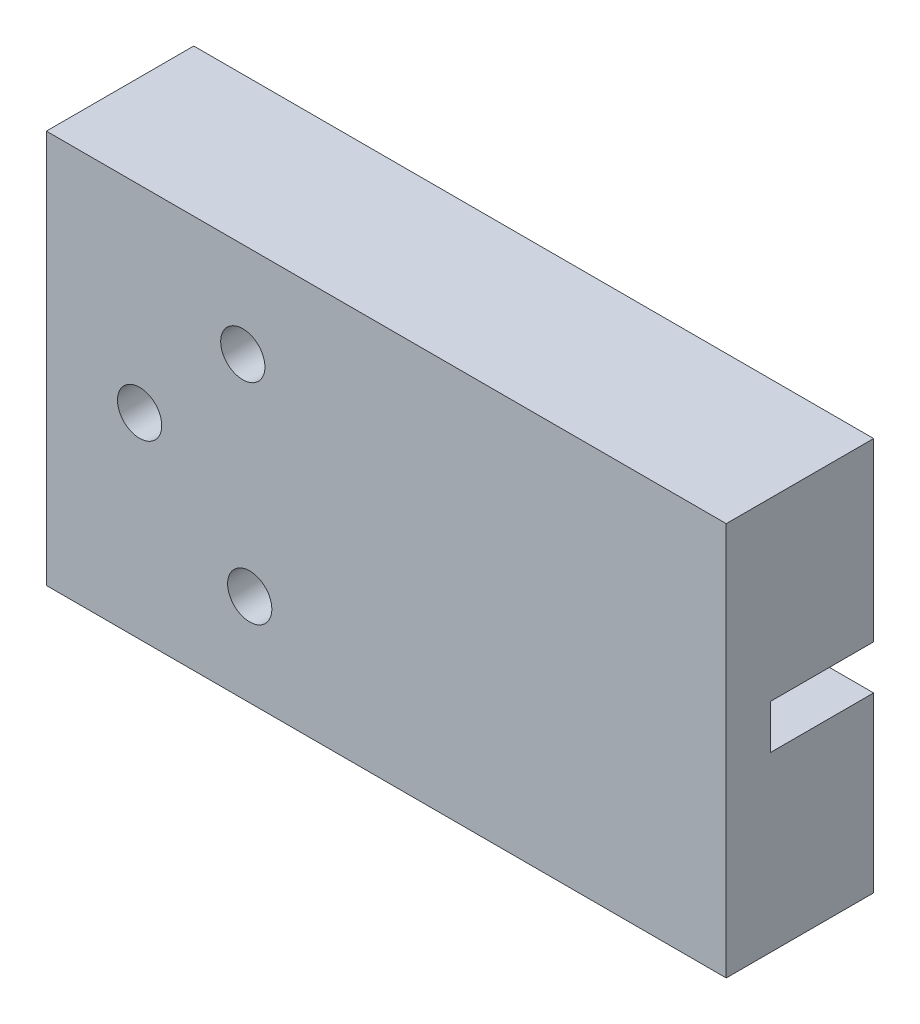
from build123d import *

# Parameters (mm, degrees)
ESQUISSE1_R             = 50
BOSS_EXTRU_1_DEPTH      = 10
ESQUISSE2_R             = 10
ENL_V_MAT_EXTRU_1_DEPTH = 7
ESQUISSE4_W             = 52.254082237
ESQUISSE4_H             = 3
ENL_V_MAT_EXTRU_2_DEPTH = 7
ESQUISSE6_W             = 109.070687356
ESQUISSE6_H             = 40.053485354
ENL_V_MAT_EXTRU_3_DEPTH = 10
ESQUISSE8_W             = 43.455454537
ESQUISSE8_H             = 73.019440826
ENL_V_MAT_EXTRU_4_DEPTH = 10
ESQUISSE9_W             = 83.209839814
ESQUISSE9_H             = 41.336413251
ENL_V_MAT_EXTRU_5_DEPTH = 10
ESQUISSE10_W            = 31.997575123
ESQUISSE10_H            = 50.623415865
ENL_V_MAT_EXTRU_6_DEPTH = 10
ESQUISSE11_R            = 1.5
ENL_V_MAT_EXTRU_7_DEPTH = 10
ESQUISSE12_R            = 1.5
ENL_V_MAT_EXTRU_8_DEPTH = 10
ESQUISSE13_R            = 1.5
ENL_V_MAT_EXTRU_9_DEPTH = 10


with BuildPart() as part:
    # Esquisse1 → Boss.-Extru.1 (new body)
    with BuildSketch(Plane.XY):
        with Locations((-18.393953774, 17.863079719)):
            Circle(ESQUISSE1_R)
    extrude(amount=BOSS_EXTRU_1_DEPTH)

    # Esquisse2 → Enlèv. mat.-Extru.1 (cut)
    with BuildSketch(Plane(origin=(0, 0, 0), x_dir=(-1, 0, 0), z_dir=(0, 0, -1))):
        with Locations((18.393953774, 17.863079719)):
            Circle(ESQUISSE2_R)
    extrude(amount=-ENL_V_MAT_EXTRU_1_DEPTH, mode=Mode.SUBTRACT)

    # Esquisse4 → Enlèv. mat.-Extru.2 (cut)
    with BuildSketch(Plane(origin=(0, 0, 0), x_dir=(-1, 0, 0), z_dir=(0, 0, -1))):
        with Locations((-12.461439017, 17.863079719)):
            Rectangle(ESQUISSE4_W, ESQUISSE4_H)
    extrude(amount=-ENL_V_MAT_EXTRU_2_DEPTH, mode=Mode.SUBTRACT)

    # Esquisse6 → Enlèv. mat.-Extru.3 (cut)
    with BuildSketch(Plane(origin=(0, 0, 0), x_dir=(-1, 0, 0), z_dir=(0, 0, -1))):
        with Locations((22.721030159, 51.335342826)):
            Rectangle(ESQUISSE6_W, ESQUISSE6_H)
    extrude(amount=-ENL_V_MAT_EXTRU_3_DEPTH, mode=Mode.SUBTRACT)

    # Esquisse8 → Enlèv. mat.-Extru.4 (cut)
    with BuildSketch(Plane(origin=(0, 0, 0), x_dir=(-1, 0, 0), z_dir=(0, 0, -1))):
        with Locations((53.615379414, 4.486243449)):
            Rectangle(ESQUISSE8_W, ESQUISSE8_H)
    extrude(amount=-ENL_V_MAT_EXTRU_4_DEPTH, mode=Mode.SUBTRACT)

    # Esquisse9 → Enlèv. mat.-Extru.5 (cut)
    with BuildSketch(Plane(origin=(0, 0, 0), x_dir=(-1, 0, 0), z_dir=(0, 0, -1))):
        with Locations((0.000153838, -16.052922386)):
            Rectangle(ESQUISSE9_W, ESQUISSE9_H)
    extrude(amount=-ENL_V_MAT_EXTRU_5_DEPTH, mode=Mode.SUBTRACT)

    # Esquisse10 → Enlèv. mat.-Extru.6 (cut)
    with BuildSketch(Plane(origin=(0, 0, 0), x_dir=(-1, 0, 0), z_dir=(0, 0, -1))):
        with Locations((-30.231359533, 14.74109753)):
            Rectangle(ESQUISSE10_W, ESQUISSE10_H)
    extrude(amount=-ENL_V_MAT_EXTRU_6_DEPTH, mode=Mode.SUBTRACT)

    # Esquisse11 → Enlèv. mat.-Extru.7 (cut)
    with BuildSketch(Plane(origin=(0, 0, 7), x_dir=(-1, 0, 0), z_dir=(0, 0, -1))):
        with Locations((18.562135855, 24.863079719)):
            Circle(ESQUISSE11_R)
    extrude(amount=-ENL_V_MAT_EXTRU_7_DEPTH, mode=Mode.SUBTRACT)

    # Esquisse12 → Enlèv. mat.-Extru.8 (cut)
    with BuildSketch(Plane(origin=(0, 0, 7), x_dir=(-1, 0, 0), z_dir=(0, 0, -1))):
        with Locations((18.091706497, 10.869608008)):
            Circle(ESQUISSE12_R)
    extrude(amount=-ENL_V_MAT_EXTRU_8_DEPTH, mode=Mode.SUBTRACT)

    # Esquisse13 → Enlèv. mat.-Extru.9 (cut)
    with BuildSketch(Plane(origin=(0, 0, 7), x_dir=(-1, 0, 0), z_dir=(0, 0, -1))):
        with Locations((25.562135855, 17.922146646)):
            Circle(ESQUISSE13_R)
    extrude(amount=-ENL_V_MAT_EXTRU_9_DEPTH, mode=Mode.SUBTRACT)


solid = part.part
